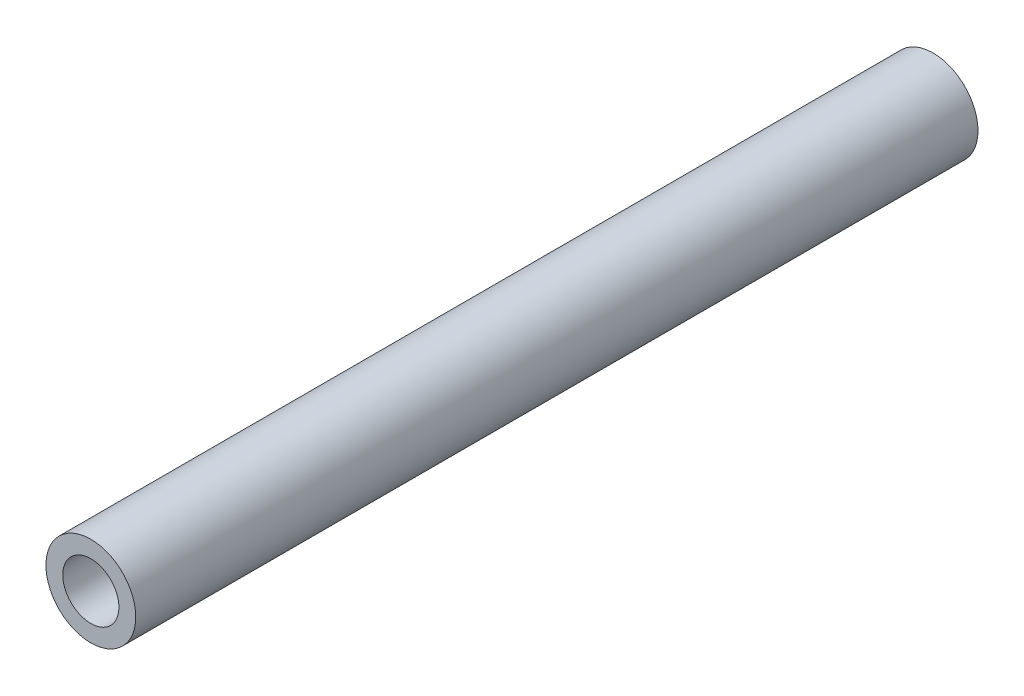
from build123d import *

# Parameters (mm, degrees)
SKETCH1_R           = 16
SKETCH1_R_2         = 10
BOSS_EXTRUDE1_DEPTH = 300


with BuildPart() as part:
    # Sketch1 → Boss-Extrude1 (new body)
    with BuildSketch(Plane.XY):
        Circle(SKETCH1_R)
        Circle(SKETCH1_R_2, mode=Mode.SUBTRACT)
    extrude(amount=BOSS_EXTRUDE1_DEPTH)


solid = part.part
